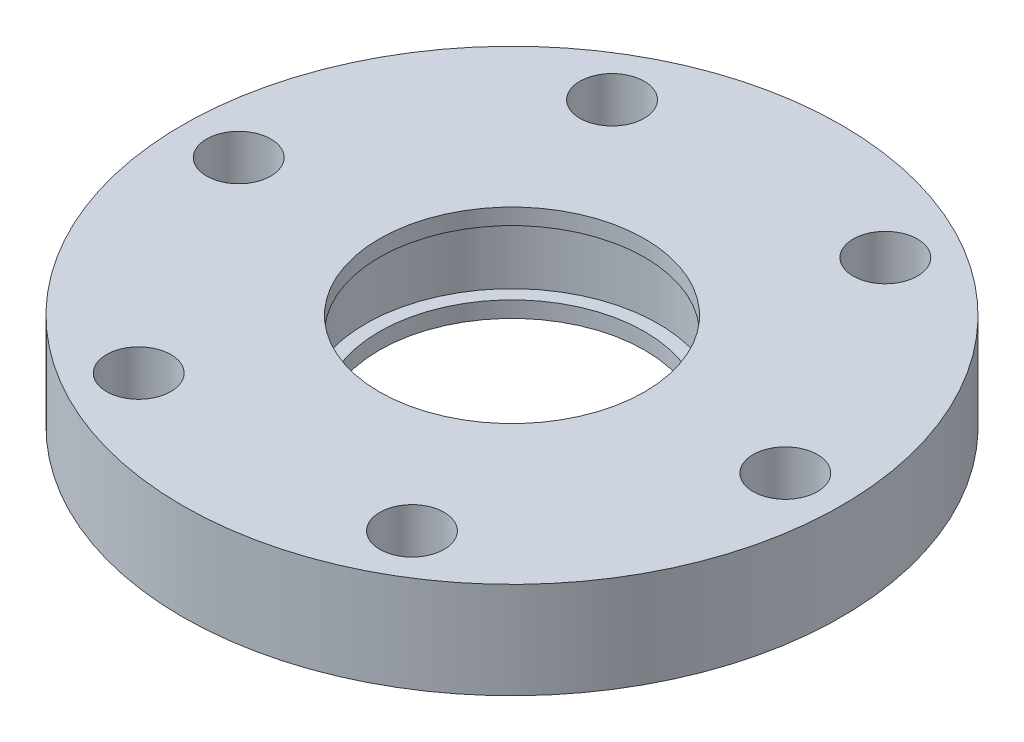
from build123d import *

# Parameters (mm, degrees)
SKETCH1_R           = 20.5
SKETCH1_R_2         = 2
SKETCH1_R_3         = 8.25
BOSS_EXTRUDE1_DEPTH = 3
SKETCH2_R           = 9.1
CUT_EXTRUDE1_DEPTH  = 2
SKETCH3_R           = 19
SKETCH3_R_2         = 15
BOSS_EXTRUDE2_DEPTH = 1


with BuildPart() as part:
    # Sketch1 → Boss-Extrude1 (new, symmetric)
    with BuildSketch(Plane(origin=(0, 0, 0), x_dir=(1, 0, 0), z_dir=(0, 1, 0))):
        Circle(SKETCH1_R)
        with Locations((17, 0)):
            Circle(SKETCH1_R_2, mode=Mode.SUBTRACT)
        with Locations((8.5, -14.722431864)):
            Circle(SKETCH1_R_2, mode=Mode.SUBTRACT)
        with Locations((-8.5, -14.722431864)):
            Circle(SKETCH1_R_2, mode=Mode.SUBTRACT)
        with Locations((-17, 0)):
            Circle(SKETCH1_R_2, mode=Mode.SUBTRACT)
        with Locations((-8.5, 14.722431864)):
            Circle(SKETCH1_R_2, mode=Mode.SUBTRACT)
        with Locations((8.5, 14.722431864)):
            Circle(SKETCH1_R_2, mode=Mode.SUBTRACT)
        Circle(SKETCH1_R_3, mode=Mode.SUBTRACT)
    extrude(amount=BOSS_EXTRUDE1_DEPTH, both=True)

    # Sketch2 → Cut-Extrude1 (cut, symmetric)
    with BuildSketch(Plane(origin=(0, 0, 0), x_dir=(1, 0, 0), z_dir=(0, 1, 0))):
        Circle(SKETCH2_R)
    extrude(amount=CUT_EXTRUDE1_DEPTH, both=True, mode=Mode.SUBTRACT)

    # Sketch3 → Boss-Extrude2 (add)
    with BuildSketch(Plane(origin=(0, -3, 0), x_dir=(1, 0, 0), z_dir=(0, 1, 0))):
        Circle(SKETCH3_R)
        Circle(SKETCH3_R_2, mode=Mode.SUBTRACT)
    extrude(amount=BOSS_EXTRUDE2_DEPTH)


solid = part.part
